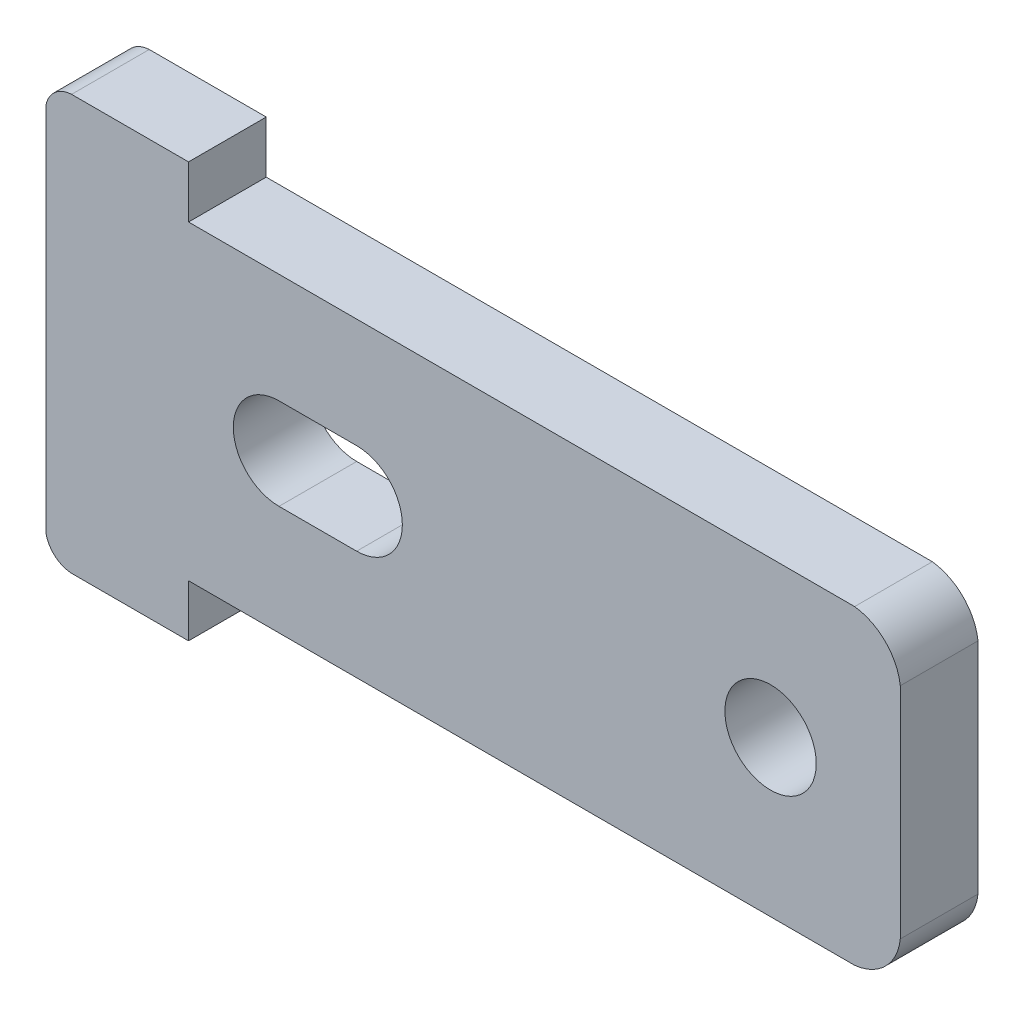
from build123d import *

# Parameters (mm, degrees)
ROBOTCHASSIS1_START = 54.665073828
ROBOTCHASSIS1_DEPTH = 3.000000026
SKETCH1_R           = 1.763889566
BOSS_EXTRUDE2_DEPTH = 3.000000026


# Read off the part's stored shape, not the designer's step: RobotChassis1
with BuildPart() as part:
    # RobotChassis1 outline → RobotChassis1 (new body)
    with BuildSketch(Plane.XY.offset(ROBOTCHASSIS1_START)):
        Polygon((78.391484289, 73.860644449), (78.215099244, 74.037033219), (78.038699298, 74.142797936), (77.826834588, 74.248562653), (77.615297704, 74.354670097), (77.403775721, 74.424951424), (77.191881209, 74.460434814), (51.474607854, 74.460434814), (51.474607854, 76.471339066), (46.958781152, 76.471339066), (46.782381206, 76.435855676), (46.605996161, 76.400715013), (46.46509078, 76.330094684), (46.323842673, 76.224326242), (46.182937293, 76.118561525), (46.11232069, 75.977313419), (46.006552248, 75.800920923), (45.971072583, 75.624535878), (45.971072583, 61.301893641), (46.006552248, 61.125501145), (46.11232069, 60.9491161), (46.182937293, 60.807867993), (46.323842673, 60.702103276), (46.46509078, 60.59633856), (46.605996161, 60.525714506), (46.782381206, 60.490231116), (46.958781152, 60.455090453), (51.474607854, 60.455090453), (51.474607854, 62.46599098), (77.191881209, 62.46599098), (77.403775721, 62.501131643), (77.826834588, 62.64237975), (78.038699298, 62.78328513), (78.215099244, 62.889392574), (78.391484289, 63.030297954), (78.53238967, 63.206686725), (78.673637776, 63.383075495), (78.779391317, 63.594947655), (78.920654326, 64.018006523), (78.955791264, 64.229882408), (78.955791264, 72.69654711), (78.920654326, 72.908076544), (78.850022822, 73.119948704), (78.779391317, 73.331478138), (78.673637776, 73.507866908), (78.53238967, 73.719396342), align=None)
        Polygon((58.177388578, 70.19161721), (58.388910561, 70.156476547), (58.600447445, 70.085852493), (58.77683249, 70.01522844), (58.953217535, 69.909463723), (59.12960258, 69.768562068), (59.270850687, 69.627310236), (59.412098794, 69.45091774), (59.517867236, 69.274532695), (59.58849874, 69.063003261), (59.658772616, 68.886614491), (59.694252281, 68.67474233), (59.729404121, 68.463212897), (59.694252281, 68.251340736), (59.658772616, 68.039811303), (59.58849874, 67.828281869), (59.517867236, 67.651893098), (59.412098794, 67.475504328), (59.270850687, 67.299111832), (59.12960258, 67.157867451), (58.953217535, 67.016619344), (58.77683249, 66.910854627), (58.600447445, 66.840230574), (58.388910561, 66.769949247), (58.177388578, 66.734465857), (57.965508967, 66.699325193), (54.966903596, 66.699325193), (54.755366712, 66.734465857), (54.543502002, 66.769949247), (54.331965118, 66.840230574), (54.155580072, 66.910854627), (53.979195027, 67.016619344), (53.802795081, 67.157867451), (53.661546974, 67.299111832), (53.520641594, 67.475504328), (53.414873152, 67.651893098), (53.344256549, 67.828281869), (53.273639946, 68.039811303), (53.238488107, 68.251340736), (53.203008442, 68.463212897), (53.238488107, 68.67474233), (53.273639946, 68.886614491), (53.344256549, 69.063003261), (53.414873152, 69.274532695), (53.520641594, 69.45091774), (53.661546974, 69.627310236), (53.802795081, 69.768562068), (53.979195027, 69.909463723), (54.155580072, 70.01522844), (54.331965118, 70.085852493), (54.543502002, 70.156476547), (54.755366712, 70.19161721), (54.966903596, 70.227104325), (57.965508967, 70.227104325), align=None, mode=Mode.SUBTRACT)
        Polygon((74.581555395, 70.085852493), (74.79309228, 70.01522844), (74.969462423, 69.909463723), (75.11071053, 69.768562068), (75.287110477, 69.627310236), (75.49863246, 69.274532695), (75.604400902, 69.063003261), (75.675017505, 68.886614491), (75.710169344, 68.67474233), (75.710169344, 68.251340736), (75.675017505, 68.039811303), (75.604400902, 67.828281869), (75.287110477, 67.299111832), (75.11071053, 67.157867451), (74.969462423, 67.016619344), (74.79309228, 66.910854627), (74.581555395, 66.840230574), (74.369675784, 66.769949247), (74.158153801, 66.734465857), (73.94627419, 66.699325193), (73.769889145, 66.734465857), (73.558352261, 66.769949247), (73.346830278, 66.840230574), (73.134950667, 66.910854627), (72.958565621, 67.016619344), (72.817660241, 67.157867451), (72.641275196, 67.299111832), (72.535164027, 67.475504328), (72.323627143, 67.828281869), (72.25301054, 68.039811303), (72.217873602, 68.251340736), (72.217873602, 68.67474233), (72.25301054, 68.886614491), (72.323627143, 69.063003261), (72.429395585, 69.274532695), (72.535164027, 69.45091774), (72.641275196, 69.627310236), (72.817660241, 69.768562068), (72.958565621, 69.909463723), (73.134950667, 70.01522844), (73.346830278, 70.085852493), (73.558352261, 70.156476547), (73.769889145, 70.19161721), (73.94627419, 70.227104325), (74.158153801, 70.19161721), (74.369675784, 70.156476547), align=None, mode=Mode.SUBTRACT)
    extrude(amount=ROBOTCHASSIS1_DEPTH)


with BuildPart() as body_2:
    # Sketch1 → Boss-Extrude2 (new body)
    with BuildSketch(Plane.XY.offset(57.665073854)):
        with BuildLine():
            Line((51.474607854, 74.460434814), (77.191881209, 74.460434814))
            ThreePointArc((77.191881209, 74.460434814), (78.378212032, 73.882870615), (78.955791264, 72.69654711))
            Line((78.955791264, 72.69654711), (78.955791264, 64.229882408))
            ThreePointArc((78.955791264, 64.229882408), (78.386068245, 63.035701388), (77.191881209, 62.46599098))
            Line((77.191881209, 62.46599098), (51.474607854, 62.46599098))
            Line((51.474607854, 62.46599098), (51.474607854, 60.455090453))
            Line((51.474607854, 60.455090453), (46.958781152, 60.455090453))
            ThreePointArc((46.958781152, 60.455090453), (46.319168008, 60.708479372), (45.971072583, 61.301893641))
            Line((45.971072583, 61.301893641), (45.971072583, 75.624535878))
            ThreePointArc((45.971072583, 75.624535878), (46.319165637, 76.217952912), (46.958781152, 76.471339066))
            Line((46.958781152, 76.471339066), (51.474607854, 76.471339066))
            Line((51.474607854, 76.471339066), (51.474607854, 74.460434814))
        make_face()
        with Locations((73.94627419, 68.463214759)):
            Circle(SKETCH1_R, mode=Mode.SUBTRACT)
        with BuildLine():
            Line((57.965508967, 66.699325193), (54.966903596, 66.699325193))
            ThreePointArc((54.966903596, 66.699325193), (53.20301403, 68.463214759), (54.966903596, 70.227104325))
            Line((54.966903596, 70.227104325), (57.965508967, 70.227104325))
            ThreePointArc((57.965508967, 70.227104325), (59.729398533, 68.463214759), (57.965508967, 66.699325193))
        make_face(mode=Mode.SUBTRACT)
    extrude(amount=-BOSS_EXTRUDE2_DEPTH)


solid = body_2.part
